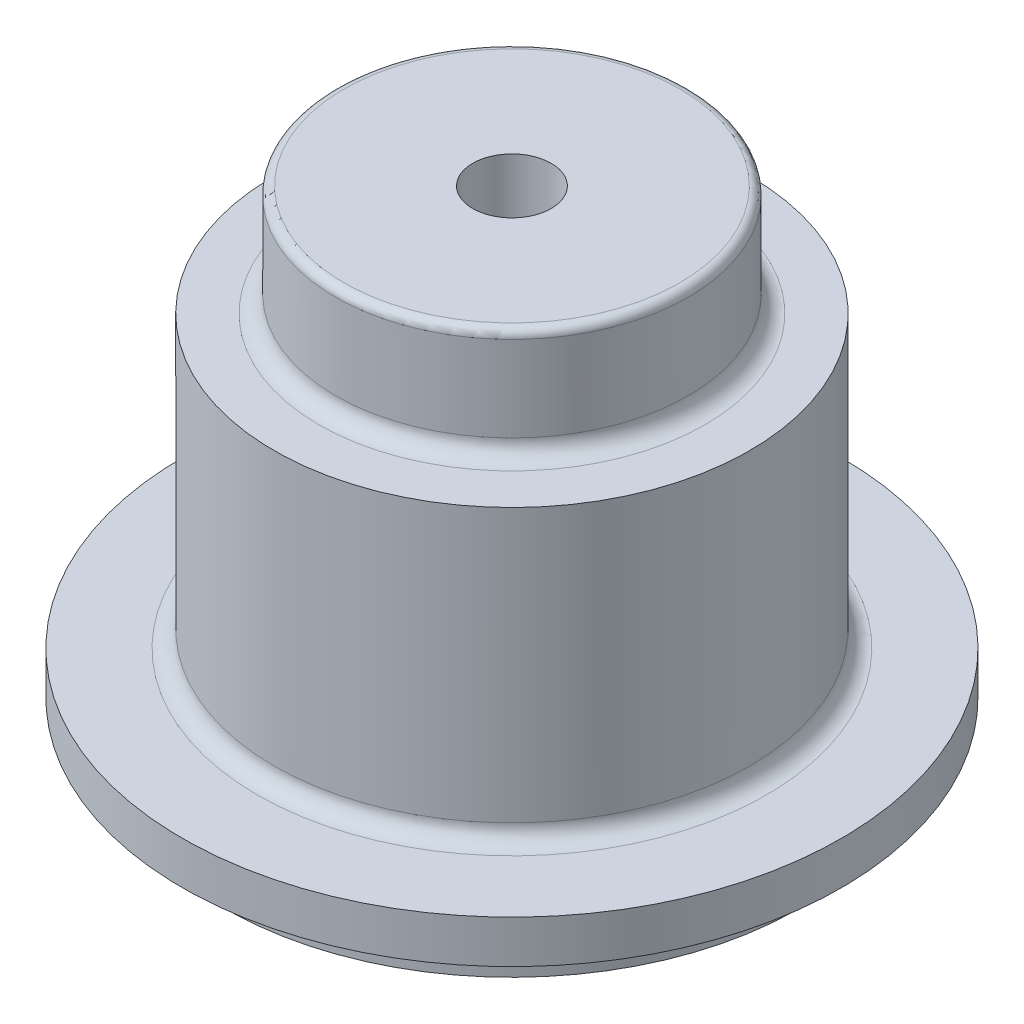
from build123d import *

# Parameters (mm, degrees)
FILLET2_R = 1.27
FILLET3_R = 0.635


with BuildPart() as part:
    # Sketch1 → Revolve4 (revolve)
    with BuildSketch(Plane.XY):
        Polygon((0, 28.23587128), (0, 25.3), (2.830568931, 25.3), (2.974741934, 25.3), (12.334639896, 25.3), (12.334639896, 0), (21.75, 0), (21.75, 3), (25, 3), (25, 6.25), (18.035610483, 6.25), (18.035610483, 28.23587128), (13.370385965, 28.23587128), (13.370385965, 36.611095198), (2.974741934, 36.611095198), (2.974741934, 28.23587128), align=None)
    revolve(axis=Axis((0, 0, 0), (0, 1, 0)))

    # Fillet2
    fillet2_edges = [part.edges().sort_by_distance(p)[0] for p in [
        (-18.035610483, 6.25, 0),
        (-13.370385965, 28.23587128, 0),
    ]]
    fillet(fillet2_edges, radius=FILLET2_R)

    # Fillet3
    fillet3_edges = [part.edges().sort_by_distance(p)[0] for p in [
        (-13.370385965, 36.611095198, 0),
    ]]
    fillet(fillet3_edges, radius=FILLET3_R)


solid = part.part
